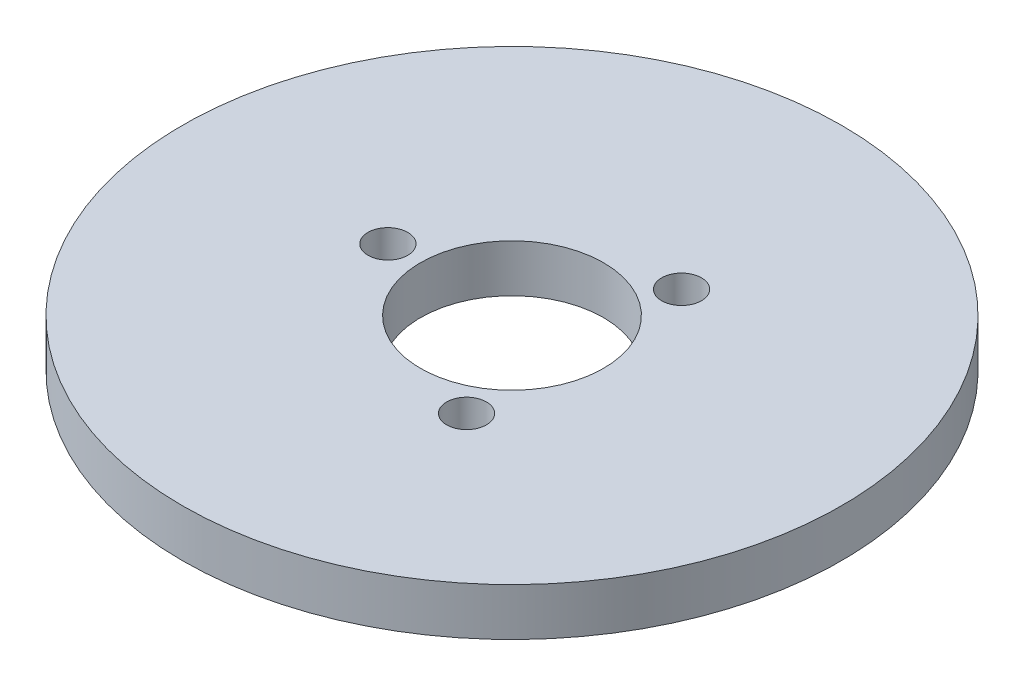
from build123d import *

# Parameters (mm, degrees)
SKETCH1_R           = 90
BOSS_EXTRUDE1_DEPTH = 13
SKETCH2_R           = 25
CUT_EXTRUDE1_DEPTH  = 128.941392833
SKETCH3_R           = 5.434212322
CUT_EXTRUDE2_DEPTH  = 11.967453468
CIRPATTERN1_COUNT   = 3


with BuildPart() as part:
    # Sketch1 → Boss-Extrude1 (new body)
    with BuildSketch(Plane(origin=(0, 0, 0), x_dir=(1, 0, 0), z_dir=(0, 1, 0))):
        Circle(SKETCH1_R)
    extrude(amount=BOSS_EXTRUDE1_DEPTH)

    # Sketch2 → Cut-Extrude1 (cut, through all)
    with BuildSketch(Plane(origin=(0, 0, 0), x_dir=(1, 0, 0), z_dir=(0, 1, 0))):
        Circle(SKETCH2_R)
    extrude(amount=CUT_EXTRUDE1_DEPTH, mode=Mode.SUBTRACT)

    # Sketch3 → Cut-Extrude2 (cut)
    with BuildSketch(Plane(origin=(0, 13, 0), x_dir=(1, 0, 0), z_dir=(0, 1, 0))):
        with Locations((-33.896773813, 0)):
            Circle(SKETCH3_R)
    cut_extrude2 = extrude(amount=-CUT_EXTRUDE2_DEPTH, mode=Mode.SUBTRACT)

    # CirPattern1: Cut-Extrude2 ×3 about axis
    cirpattern1_axis = Axis((0, 0, 0), (0, 1, 0))
    for i in range(1, CIRPATTERN1_COUNT):
        add(cut_extrude2.rotate(cirpattern1_axis, i * 360 / CIRPATTERN1_COUNT), mode=Mode.SUBTRACT)


solid = part.part
